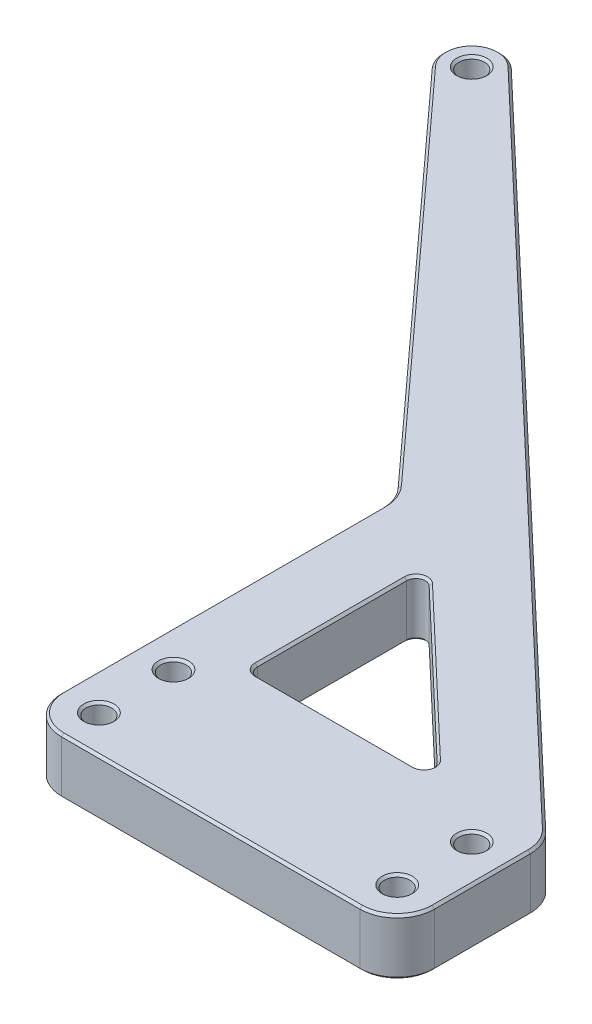
from build123d import *

# Parameters (mm, degrees)
SKETCH1_R               = 2.1828125
BOSS_EXTRUDE1_DEPTH     = 9.525
CUT_EXTRUDE2_DEPTH      = 149.700541147
CUT_EXTRUDE2_DEPTH_BACK = 149.700541147
CHAMFER1_SIZE           = 0.396875


with BuildPart() as part:
    # Sketch1 → Boss-Extrude1 (new body)
    with BuildSketch(Plane(origin=(0, 0, 0), x_dir=(1, 0, 0), z_dir=(0, 1, 0))):
        with BuildLine():
            Line((50.8, -6.35), (0, -6.35))
            ThreePointArc((0, -6.35), (-4.490128061, -4.490128061), (-6.35, 0))
            Line((-6.35, 0), (-6.35, 54.692459232))
            ThreePointArc((-6.35, 54.692459232), (-6.778028156, 56.984346985), (-8.004409284, 58.967260727))
            Line((-8.004409284, 58.967260727), (-67.021693037, 123.793898879))
            ThreePointArc((-67.021693037, 123.793898879), (-66.832395856, 130.402432087), (-60.221355188, 130.454257437))
            Line((-60.221355188, 130.454257437), (55.171526417, 20.927889031))
            ThreePointArc((55.171526417, 20.927889031), (56.634453391, 18.828535178), (57.15, 16.322212447))
            Line((57.15, 16.322212447), (57.15, 0))
            ThreePointArc((57.15, 0), (55.290128061, -4.490128061), (50.8, -6.35))
        make_face()
        Circle(SKETCH1_R, mode=Mode.SUBTRACT)
        with Locations((50.8, 12.7)):
            Circle(SKETCH1_R, mode=Mode.SUBTRACT)
        with Locations((-63.5, 127)):
            Circle(SKETCH1_R, mode=Mode.SUBTRACT)
        with Locations((0, 12.7)):
            Circle(SKETCH1_R, mode=Mode.SUBTRACT)
        with Locations((50.8, 0)):
            Circle(SKETCH1_R, mode=Mode.SUBTRACT)
    extrude(amount=BOSS_EXTRUDE1_DEPTH)

    # Sketch3 → Cut-Extrude2 (cut, two sides: drawn at the far end of the back side and taken through both)
    with BuildSketch(Plane(origin=(0, 0, 0), x_dir=(1, 0, 0), z_dir=(0, 1, 0)).offset(-CUT_EXTRUDE2_DEPTH_BACK)):
        with BuildLine():
            Line((9.030381604, 47.213328586), (35.81658762, 21.788919146))
            ThreePointArc((35.81658762, 21.788919146), (36.198160855, 20.04916406), (34.723706016, 19.05))
            Line((34.723706016, 19.05), (7.9375, 19.05))
            ThreePointArc((7.9375, 19.05), (6.814967985, 19.514967985), (6.35, 20.6375))
            Line((6.35, 20.6375), (6.35, 46.06190944))
            ThreePointArc((6.35, 46.06190944), (7.310919317, 47.520522788), (9.030381604, 47.213328586))
        make_face()
    extrude(amount=CUT_EXTRUDE2_DEPTH + CUT_EXTRUDE2_DEPTH_BACK, mode=Mode.SUBTRACT)

    # Chamfer1
    chamfer1_edges = [part.edges().sort_by_distance(p)[0] for p in [
        (-65.6828125, 9.525, -127),
        (-2.1828125, 9.525, 0),
        (25.4, 9.525, 6.35),
        (-4.490128061, 9.525, 4.490128061),
        (-6.35, 9.525, -27.346229616),
        (-6.778028156, 9.525, -56.984346985),
        (-37.51305116, 9.525, -91.380579803),
        (-66.832395856, 9.525, -130.402432087),
        (-2.524914386, 9.525, -75.691073234),
        (56.634453391, 9.525, -18.828535178),
        (57.15, 9.525, -8.161106224),
        (55.290128061, 9.525, 4.490128061),
        (48.6171875, 9.525, -12.7),
        (21.330603008, 0, -19.05),
        (6.814967985, 0, -19.514967985),
        (6.35, 0, -33.34970472),
        (7.310919317, 0, -47.520522788),
        (22.423484612, 0, -34.501123866),
        (36.198160855, 0, -20.04916406),
        (57.15, 0, -8.161106224),
        (56.634453391, 0, -18.828535178),
        (-2.524914386, 0, -75.691073234),
        (-66.832395856, 0, -130.402432087),
        (-37.51305116, 0, -91.380579803),
        (-6.778028156, 0, -56.984346985),
        (-6.35, 0, -27.346229616),
        (-4.490128061, 0, 4.490128061),
        (25.4, 0, 6.35),
        (55.290128061, 0, 4.490128061),
        (-2.1828125, 0, 0),
        (48.6171875, 0, -12.7),
        (-65.6828125, 0, -127),
        (7.310919317, 9.525, -47.520522788),
        (6.35, 9.525, -33.34970472),
        (6.814967985, 9.525, -19.514967985),
        (21.330603008, 9.525, -19.05),
        (36.198160855, 9.525, -20.04916406),
        (22.423484612, 9.525, -34.501123866),
        (48.6171875, 9.525, 0),
        (-2.1828125, 9.525, -12.7),
        (-2.1828125, 0, -12.7),
        (48.6171875, 0, 0),
    ]]
    chamfer(chamfer1_edges, length=CHAMFER1_SIZE)


solid = part.part
